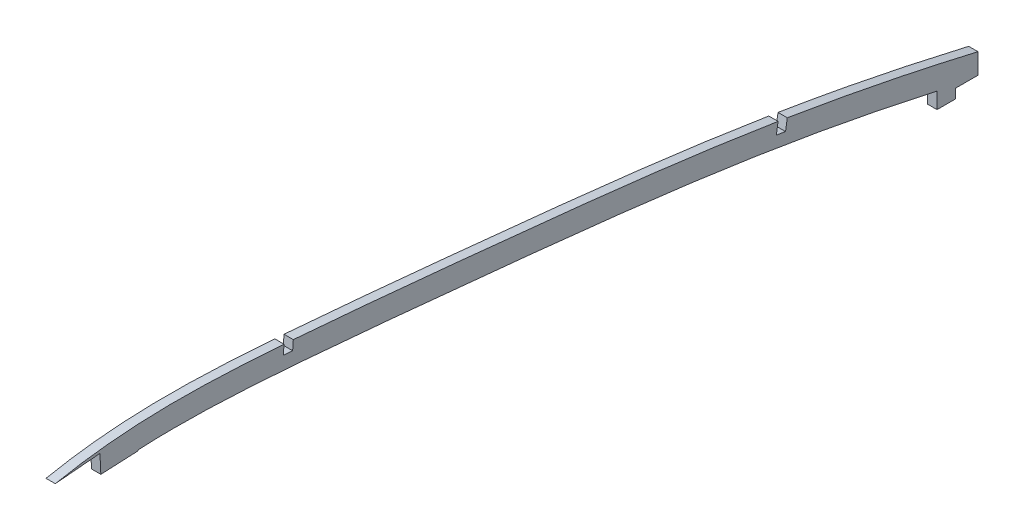
from build123d import *

# Parameters (mm, degrees)
BOSS_EXTRUDE1_DEPTH = 3.175
CUT_EXTRUDE2_DEPTH  = 654.189890262


# Read off the part's stored shape, not the designer's step: Boss-Extrude1
with BuildPart() as part:
    # Boss-Extrude1 outline → Boss-Extrude1 (new body)
    with BuildSketch(Plane.ZY.offset(-374.396)):
        with BuildLine():
            Line((-350.005555185, 67.737635502), (-334.782029636, 66.399219608))
            add(Edge.make_bspline(
                [(-334.782029636, 66.399219608), (-341.240992873, 67.71308737), (-347.74232472, 68.638657355), (-360.813939728, 69.857875705), (-367.384157752, 70.152121032), (-377.278023699, 70.240289498), (-380.582377007, 70.21104298), (-387.201130434, 70.060473417), (-390.515432634, 69.93917268), (-400.442556531, 69.475337941), (-407.050981704, 69.038378743), (-420.258917861, 68.046554904), (-426.858412994, 67.491480581), (-440.052925111, 66.322100745), (-446.647894367, 65.707163942), (-459.835648192, 64.448394083), (-466.427223814, 63.804330657), (-479.607322045, 62.50019263), (-486.195809267, 61.839186708), (-499.368381394, 60.491985482), (-505.952419458, 59.805522168), (-519.112316449, 58.385795781), (-525.688093125, 57.65206208), (-538.826196256, 56.107634603), (-545.388480731, 55.296700626), (-558.494335759, 53.567754504), (-571.581318222, 51.730822492), (-584.623705512, 49.638723817), (-597.641863597, 47.407989391), (-604.13891642, 46.223810013), (-623.594156247, 42.465750982), (-636.516219668, 39.685177786), (-649.396489798, 36.665469863)],
                knots=[0, 0, 0, 0, 0.0625, 0.0625, 0.125, 0.125, 0.15625, 0.15625, 0.1875, 0.1875, 0.25, 0.25, 0.3125, 0.3125, 0.375, 0.375, 0.4375, 0.4375, 0.5, 0.5, 0.5625, 0.5625, 0.625, 0.625, 0.6875, 0.6875, 0.75, 0.8125, 0.8125, 0.875, 0.875, 1, 1, 1, 1], degree=3))
            Line((-649.396489798, 36.665469863), (-649.396489798, 29.706488542))
            Line((-649.396489798, 29.706488542), (-641.776489798, 29.706488949))
            Line((-641.776489798, 29.706488949), (-641.776489798, 26.531488949))
            Line((-641.776489798, 26.531488949), (-635.426489798, 26.531488949))
            Line((-635.426489798, 26.531488949), (-635.426489798, 32.037642177))
            add(Edge.make_bspline(
                [(-635.426489798, 32.037642177), (-626.699809587, 33.973901403), (-605.09971112, 38.470828669), (-570.497357953, 44.389700719), (-531.419980681, 49.46349027), (-492.027742402, 53.62689392), (-452.50992836, 57.538262976), (-419.617452947, 60.566295678), (-393.439667345, 62.303633962), (-376.715776716, 62.747417071), (-366.64401335, 62.448215888), (-362.974756295, 62.248064299)],
                knots=[0.039842207, 0.039842207, 0.039842207, 0.039842207, 0.125, 0.25, 0.375, 0.5, 0.625, 0.75, 0.8125, 0.875, 0.911151113, 0.911151113, 0.911151113, 0.911151113], degree=3))
            Line((-362.974756295, 62.248064299), (-362.98694118, 61.986221215))
            Line((-362.98694118, 61.986221215), (-350.300669898, 61.395864564))
            Line((-350.300669898, 61.395864564), (-350.005555185, 67.737635502))
        make_face()
    extrude(amount=BOSS_EXTRUDE1_DEPTH)

    # Sketch4 → Cut-Extrude2 (cut, through all)
    with BuildSketch(Plane(origin=(374.396, 0, 0), x_dir=(0, 0, -1), z_dir=(1, 0, 0))):
        Polygon((412.770923092, 68.608490806), (412.535760157, 65.442211698), (415.702039265, 65.207048762), (415.936865021, 68.368788015), (416.025397802, 69.560810453), (412.859118694, 69.795973389), align=None)
        Polygon((581.238436134, 50.164660341), (580.634677235, 46.402802397), (583.769558855, 45.899669981), (584.372489798, 49.656369157), (584.640659894, 51.327264289), (581.505778274, 51.830396705), align=None)
    extrude(amount=-CUT_EXTRUDE2_DEPTH, mode=Mode.SUBTRACT)


solid = part.part
